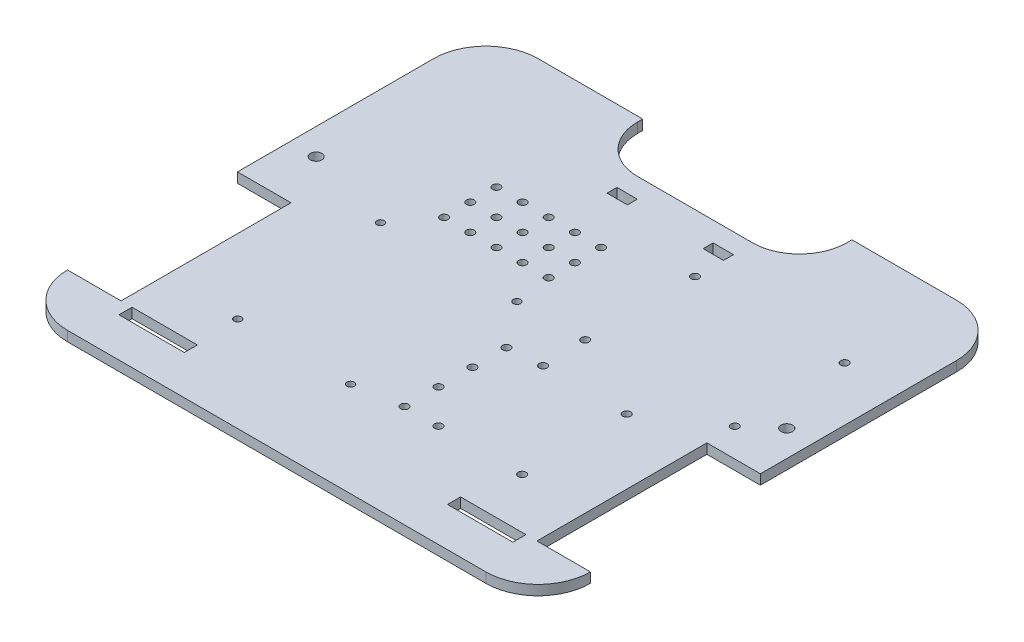
from build123d import *

# Parameters (mm, degrees)
SKETCH1_W           = 254
SKETCH1_H           = 228.6
BOSS_EXTRUDE1_DEPTH = 4.826
SKETCH2_W           = 26.00000007
SKETCH2_H           = 82.55
CUT_EXTRUDE1_DEPTH  = 4.826
CUT_EXTRUDE3_DEPTH  = 4.826
SKETCH7_W           = 101.6
SKETCH7_H           = 25.4
CUT_EXTRUDE5_DEPTH  = 4.826
FILLET9_R           = 22.86
FILLET10_R          = 22.86
CUT_EXTRUDE6_DEPTH  = 4.826
SKETCH9_W           = 31.75
SKETCH9_H           = 6.35
CUT_EXTRUDE7_DEPTH  = 171.929167423
SKETCH11_W          = 9.906
SKETCH11_H          = 4.826
CUT_EXTRUDE8_DEPTH  = 171.929167423
SKETCH13_R          = 1.905
CUT_EXTRUDE10_DEPTH = 171.929167423
SKETCH14_R          = 1.778
CUT_EXTRUDE11_DEPTH = 171.929167423
SKETCH15_R          = 1.905
CUT_EXTRUDE12_DEPTH = 171.929167423
SKETCH16_R          = 1.905
CUT_EXTRUDE13_DEPTH = 171.929167423
SKETCH17_R          = 2.778125
CUT_EXTRUDE14_DEPTH = 171.929167423
SKETCH18_R          = 1.905
CUT_EXTRUDE15_DEPTH = 171.929167423


with BuildPart() as part:
    # Sketch1 → Boss-Extrude1 (new body)
    with BuildSketch(Plane(origin=(0, 0, 0), x_dir=(1, 0, 0), z_dir=(0, 1, 0))):
        Rectangle(SKETCH1_W, SKETCH1_H)
    extrude(amount=BOSS_EXTRUDE1_DEPTH)

    # Sketch2 → Cut-Extrude1 (cut)
    with BuildSketch(Plane(origin=(0, 4.826, 0), x_dir=(1, 0, 0), z_dir=(0, 1, 0))):
        with Locations((-113.999999965, -47.625)):
            Rectangle(SKETCH2_W, SKETCH2_H)
        with Locations((113.999999965, -47.625)):
            Rectangle(SKETCH2_W, SKETCH2_H)
    extrude(amount=-CUT_EXTRUDE1_DEPTH, mode=Mode.SUBTRACT)

    # Sketch4 → Cut-Extrude3 (cut)
    with BuildSketch(Plane(origin=(0, 4.826, 0), x_dir=(1, 0, 0), z_dir=(0, 1, 0))):
        with BuildLine():
            Line((-127, 88.9), (-127, 114.3))
            Line((-127, 114.3), (-101.6, 114.3))
            ThreePointArc((-101.6, 114.3), (-119.560512242, 106.860512242), (-127, 88.9))
        make_face()
        with BuildLine():
            Line((127, 88.9), (127, 114.3))
            Line((127, 114.3), (101.6, 114.3))
            ThreePointArc((101.6, 114.3), (119.560512242, 106.860512242), (127, 88.9))
        make_face()
    extrude(amount=-CUT_EXTRUDE3_DEPTH, mode=Mode.SUBTRACT)

    # Sketch7 → Cut-Extrude5 (cut)
    with BuildSketch(Plane(origin=(0, 4.826, 0), x_dir=(1, 0, 0), z_dir=(0, 1, 0))):
        with Locations((0, 101.6)):
            Rectangle(SKETCH7_W, SKETCH7_H)
    extrude(amount=-CUT_EXTRUDE5_DEPTH, mode=Mode.SUBTRACT)

    # Fillet9
    fillet9_edges = [part.edges().sort_by_distance(p)[0] for p in [
        (-50.8, 2.413, -88.9),
    ]]
    fillet(fillet9_edges, radius=FILLET9_R)

    # Fillet10
    fillet10_edges = [part.edges().sort_by_distance(p)[0] for p in [
        (50.8, 2.413, -88.9),
    ]]
    fillet(fillet10_edges, radius=FILLET10_R)

    # Sketch8 → Cut-Extrude6 (cut)
    with BuildSketch(Plane(origin=(0, 4.826, 0), x_dir=(1, 0, 0), z_dir=(0, 1, 0))):
        with BuildLine():
            Line((-127, -88.9), (-127, -114.3))
            Line((-127, -114.3), (-101.6, -114.3))
            ThreePointArc((-101.6, -114.3), (-119.560512242, -106.860512242), (-127, -88.9))
        make_face()
        with BuildLine():
            Line((127, -114.3), (101.6, -114.3))
            ThreePointArc((101.6, -114.3), (119.560512242, -106.860512242), (127, -88.9))
            Line((127, -88.9), (127, -114.3))
        make_face()
    extrude(amount=-CUT_EXTRUDE6_DEPTH, mode=Mode.SUBTRACT)

    # Sketch9 → Cut-Extrude7 (cut, through all)
    with BuildSketch(Plane.XZ):
        with Locations((-79.79099993, 92.075)):
            Rectangle(SKETCH9_W, SKETCH9_H)
        with Locations((79.79099993, 92.075)):
            Rectangle(SKETCH9_W, SKETCH9_H)
    extrude(amount=-CUT_EXTRUDE7_DEPTH, mode=Mode.SUBTRACT)

    # Sketch11 → Cut-Extrude8 (cut, through all)
    with BuildSketch(Plane(origin=(0, 4.826, 0), x_dir=(1, 0, 0), z_dir=(0, 1, 0))):
        with Locations((-23.345869789, 76.863822677)):
            Rectangle(SKETCH11_W, SKETCH11_H)
        with Locations((23.345869789, 76.863822677)):
            Rectangle(SKETCH11_W, SKETCH11_H)
    extrude(amount=-CUT_EXTRUDE8_DEPTH, mode=Mode.SUBTRACT)

    # Sketch13 → Cut-Extrude10 (cut, through all)
    with BuildSketch(Plane(origin=(0, 4.826, 0), x_dir=(1, 0, 0), z_dir=(0, 1, 0))):
        with Locations((-6.882364692, 24.715879034)):
            Circle(SKETCH13_R)
        with Locations((-19.582364692, 24.715879034)):
            Circle(SKETCH13_R)
        with Locations((-32.282364692, 24.715879034)):
            Circle(SKETCH13_R)
        with Locations((-44.982364692, 24.715879034)):
            Circle(SKETCH13_R)
        with Locations((-57.682364692, 24.715879034)):
            Circle(SKETCH13_R)
        with Locations((-19.582364692, 37.415879034)):
            Circle(SKETCH13_R)
        with Locations((-32.282364692, 37.415879034)):
            Circle(SKETCH13_R)
        with Locations((-44.982364692, 37.415879034)):
            Circle(SKETCH13_R)
        with Locations((-57.682364692, 37.415879034)):
            Circle(SKETCH13_R)
        with Locations((-19.582364692, 50.115879034)):
            Circle(SKETCH13_R)
        with Locations((-32.282364692, 50.115879034)):
            Circle(SKETCH13_R)
        with Locations((-44.982364692, 50.115879034)):
            Circle(SKETCH13_R)
        with Locations((-57.682364692, 50.115879034)):
            Circle(SKETCH13_R)
        with Locations((-6.882364692, 37.415879034)):
            Circle(SKETCH13_R)
        with Locations((-6.882364692, 50.115879034)):
            Circle(SKETCH13_R)
    extrude(amount=-CUT_EXTRUDE10_DEPTH, mode=Mode.SUBTRACT)

    # Sketch14 → Cut-Extrude11 (cut, through all)
    with BuildSketch(Plane(origin=(0, 4.826, 0), x_dir=(1, 0, 0), z_dir=(0, 1, 0))):
        with Locations((-65.048364692, -68.196408989)):
            Circle(SKETCH14_R)
        with Locations((-10.184364692, -68.196408989)):
            Circle(SKETCH14_R)
        with Locations((-70.890364692, 6.987591011)):
            Circle(SKETCH14_R)
        with Locations((-4.596364692, 6.987591011)):
            Circle(SKETCH14_R)
    extrude(amount=-CUT_EXTRUDE11_DEPTH, mode=Mode.SUBTRACT)

    # Sketch15 → Cut-Extrude12 (cut, through all)
    with BuildSketch(Plane(origin=(0, 4.826, 0), x_dir=(1, 0, 0), z_dir=(0, 1, 0))):
        with Locations((69.413857942, -64.485146072)):
            Circle(SKETCH15_R)
        with Locations((28.773857942, -64.485146072)):
            Circle(SKETCH15_R)
        with Locations((69.413857942, -13.685146072)):
            Circle(SKETCH15_R)
        with Locations((28.773857942, -13.685146072)):
            Circle(SKETCH15_R)
    extrude(amount=-CUT_EXTRUDE12_DEPTH, mode=Mode.SUBTRACT)

    # Sketch16 → Cut-Extrude13 (cut, through all)
    with BuildSketch(Plane(origin=(0, 4.826, 0), x_dir=(1, 0, 0), z_dir=(0, 1, 0))):
        with Locations((100.782857942, 7.422707891)):
            Circle(SKETCH16_R)
        with Locations((28.138857942, 7.422707891)):
            Circle(SKETCH16_R)
        with Locations((28.138857942, 60.762707891)):
            Circle(SKETCH16_R)
        with Locations((100.782857942, 60.762707891)):
            Circle(SKETCH16_R)
    extrude(amount=-CUT_EXTRUDE13_DEPTH, mode=Mode.SUBTRACT)

    # Sketch17 → Cut-Extrude14 (cut, through all)
    with BuildSketch(Plane.XZ):
        with Locations((114.3, -19.164632523)):
            Circle(SKETCH17_R)
        with Locations((-114.3, -19.164632523)):
            Circle(SKETCH17_R)
    extrude(amount=-CUT_EXTRUDE14_DEPTH, mode=Mode.SUBTRACT)

    # Sketch18 → Cut-Extrude15 (cut, through all)
    with BuildSketch(Plane(origin=(0, 4.826, 0), x_dir=(1, 0, 0), z_dir=(0, 1, 0))):
        with Locations((12.263857942, -64.485146072)):
            Circle(SKETCH18_R)
        with Locations((12.263857942, -47.975146072)):
            Circle(SKETCH18_R)
        with Locations((12.263857942, -31.465146072)):
            Circle(SKETCH18_R)
        with Locations((12.263857942, -14.955146072)):
            Circle(SKETCH18_R)
    extrude(amount=-CUT_EXTRUDE15_DEPTH, mode=Mode.SUBTRACT)


solid = part.part
